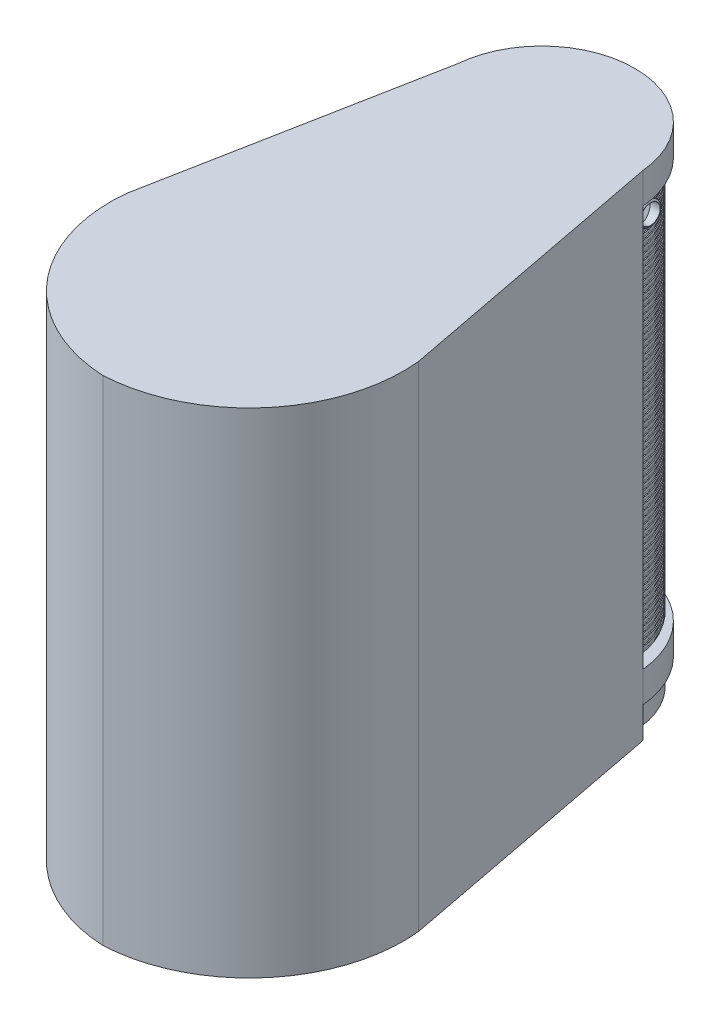
from build123d import *

# Parameters (mm, degrees)
BASE_DEPTH              = 406.4
CUT_FOR_POD_TRASH_DEPTH = 330.2
WATER_AND_CORD_DEPTH    = 330.2
POWER_DEPTH             = 25.4
POD_TRASH_BIN_DEPTH     = 327.66
SKETCH15_W              = 0.762
SKETCH15_H              = 2.54
LPATTERN3_COUNT         = 68
LPATTERN3_PITCH         = 4.826
SKETCH14_R              = 9.525
HOLE_EXTRUDE_DEPTH      = 66.04
FILLET4_R               = 1.27
SKETCH17_R              = 8.001
HOLE_CUT_DEPTH          = 538.507475527
INSIDE_DEPTH            = 317.5


with BuildPart() as part:
    # Sketch1 → Base (new body)
    with BuildSketch(Plane(origin=(0, 0, 0), x_dir=(1, 0, 0), z_dir=(0, 1, 0))):
        with BuildLine():
            Line((-119.997338688, 0), (-76.2, 228.6))
            ThreePointArc((-76.2, 228.6), (-51.663767565, 278.238745322), (0, 298.160764803))
            ThreePointArc((0, 298.160764803), (51.663767565, 278.238745322), (76.2, 228.6))
            Line((76.2, 228.6), (119.997338688, 0))
            ThreePointArc((119.997338688, 0), (89.988820959, -95.610475165), (0, -139.7))
            ThreePointArc((0, -139.7), (-89.988820959, -95.610475165), (-119.997338688, 0))
        make_face()
    extrude(amount=-BASE_DEPTH)

    # Sketch5 → Cut for pod trash (cut)
    with BuildSketch(Plane(origin=(0, -25.4, 0), x_dir=(1, 0, 0), z_dir=(0, 1, 0))):
        with BuildLine():
            Line((-76.2, 228.6), (76.2, 228.6))
            ThreePointArc((76.2, 228.6), (0, 301.750496716), (-76.2, 228.6))
        make_face()
    extrude(amount=-CUT_FOR_POD_TRASH_DEPTH, mode=Mode.SUBTRACT)

    # Sketch7 → water and cord (cut)
    with BuildSketch(Plane(origin=(0, -381, 0), x_dir=(1, 0, 0), z_dir=(0, 1, 0))):
        with BuildLine():
            Line((-76.2, 228.6), (76.2, 228.6))
            ThreePointArc((76.2, 228.6), (0, 307.702334332), (-76.2, 228.6))
        make_face()
    extrude(amount=-WATER_AND_CORD_DEPTH, mode=Mode.SUBTRACT)

    # Sketch10 → power (add)
    with BuildSketch(Plane.XZ.offset(381)):
        with BuildLine():
            Line((66.04, -229.87), (-66.04, -229.87))
            ThreePointArc((-66.04, -229.87), (0, -295.91), (66.04, -229.87))
        make_face()
    extrude(amount=POWER_DEPTH)


with BuildPart() as body_2:
    # Sketch11 → pod trash bin (new body)
    with BuildSketch(Plane(origin=(0, -355.6, 0), x_dir=(1, 0, 0), z_dir=(0, 1, 0))):
        with BuildLine():
            Line((-66.04, 229.87), (66.04, 229.87))
            ThreePointArc((66.04, 229.87), (0, 295.91), (-66.04, 229.87))
        make_face()
    extrude(amount=POD_TRASH_BIN_DEPTH)

    # Sketch15 → Cut-Revolve1 (revolve, cut)
    with BuildSketch(Plane.XY.offset(-229.87)):
        with Locations((65.659, -354.33)):
            Rectangle(SKETCH15_W, SKETCH15_H)
    cut_revolve1 = revolve(axis=Axis((0, 0, -229.87), (0, -1, 0)), mode=Mode.SUBTRACT)

    # LPattern3: Cut-Revolve1 ×68
    with Locations(*[(0, i * LPATTERN3_PITCH, 0) for i in range(1, LPATTERN3_COUNT)]):
        add(cut_revolve1, mode=Mode.SUBTRACT)

    # Sketch14 → Hole extrude (add, symmetric)
    with BuildSketch(Plane(origin=(0, 0, 0), x_dir=(0, 0, -1), z_dir=(1, 0, 0))):
        with Locations((245.11, -44.45)):
            Circle(SKETCH14_R)
    extrude(amount=HOLE_EXTRUDE_DEPTH, both=True)

    # Fillet4
    # the kernel refuses this fillet: 1.27 mm, written as the material it takes off along each edge
    with BuildSketch(Plane(origin=(66.04, -44.45, -245.11), x_dir=(0, 0, -1), z_dir=(0, -1, 0))) as fillet4_piece_1_section:
        with BuildLine():
            CenterArc((9.525 - FILLET4_R, -FILLET4_R), FILLET4_R, 0, 90)
            Line((9.525 - FILLET4_R, 0), (9.525, 0))
            Line((9.525, 0), (9.525, -FILLET4_R))
        make_face()
    fillet4_piece_1 = revolve(axis=Axis((66.04, -44.45, -245.11), (1, 0, 0)), mode=Mode.PRIVATE)
    fillet4_piece_1 = fillet4_piece_1 - Plane(origin=(0, -44.45, -229.87), x_dir=(1, 0, 0), z_dir=(0, -1, 0)) * Cylinder(66.04, 39, mode=Mode.PRIVATE)
    add(fillet4_piece_1, mode=Mode.SUBTRACT)
    with BuildSketch(Plane(origin=(66.04, -44.45, -245.11), x_dir=(0, 0, -1), z_dir=(0, -1, 0))) as fillet4_piece_2_section:
        with BuildLine():
            CenterArc((9.525 - FILLET4_R, -FILLET4_R), FILLET4_R, 0, 90)
            Line((9.525 - FILLET4_R, 0), (9.525, 0))
            Line((9.525, 0), (9.525, -FILLET4_R))
        make_face()
    fillet4_piece_2 = revolve(axis=Axis((66.04, -44.45, -245.11), (1, 0, 0)), mode=Mode.PRIVATE)
    fillet4_piece_2 = split(fillet4_piece_2, bisect_by=Plane(origin=(66.04, -37.084, -245.11), z_dir=(0, 1, 0)), keep=Keep.TOP, mode=Mode.PRIVATE)
    add(fillet4_piece_2, mode=Mode.SUBTRACT)
    with BuildSketch(Plane(origin=(66.04, -44.45, -245.11), x_dir=(0, 0, -1), z_dir=(0, -1, 0))) as fillet4_piece_3_section:
        with BuildLine():
            CenterArc((9.525 - FILLET4_R, -FILLET4_R), FILLET4_R, 0, 90)
            Line((9.525 - FILLET4_R, 0), (9.525, 0))
            Line((9.525, 0), (9.525, -FILLET4_R))
        make_face()
    fillet4_piece_3 = revolve(axis=Axis((66.04, -44.45, -245.11), (1, 0, 0)), mode=Mode.PRIVATE)
    fillet4_piece_3 = split(fillet4_piece_3, bisect_by=Plane(origin=(66.04, -51.562, -245.11), z_dir=(0, 1, 0)), keep=Keep.TOP, mode=Mode.PRIVATE)
    fillet4_piece_3 = fillet4_piece_3 - Plane(origin=(0, -44.45, -229.87), x_dir=(1, 0, 0), z_dir=(0, 1, 0)) * Cylinder(65.278, 39, mode=Mode.PRIVATE)
    fillet4_piece_3 = split(fillet4_piece_3, bisect_by=Plane(origin=(66.04, -49.022, -245.11), z_dir=(0, -1, 0)), keep=Keep.TOP, mode=Mode.PRIVATE)
    add(fillet4_piece_3, mode=Mode.SUBTRACT)
    with BuildSketch(Plane(origin=(66.04, -44.45, -245.11), x_dir=(0, 0, -1), z_dir=(0, -1, 0))) as fillet4_piece_4_section:
        with BuildLine():
            CenterArc((9.525 - FILLET4_R, -FILLET4_R), FILLET4_R, 0, 90)
            Line((9.525 - FILLET4_R, 0), (9.525, 0))
            Line((9.525, 0), (9.525, -FILLET4_R))
        make_face()
    fillet4_piece_4 = revolve(axis=Axis((66.04, -44.45, -245.11), (1, 0, 0)), mode=Mode.PRIVATE)
    fillet4_piece_4 = fillet4_piece_4 - Plane(origin=(0, -44.45, -229.87), x_dir=(1, 0, 0), z_dir=(0, 1, 0)) * Cylinder(65.278, 39, mode=Mode.PRIVATE)
    fillet4_piece_4 = split(fillet4_piece_4, bisect_by=Plane(origin=(66.04, -41.91, -245.11), z_dir=(0, 1, 0)), keep=Keep.TOP, mode=Mode.PRIVATE)
    fillet4_piece_4 = split(fillet4_piece_4, bisect_by=Plane(origin=(66.04, -39.37, -245.11), z_dir=(0, -1, 0)), keep=Keep.TOP, mode=Mode.PRIVATE)
    add(fillet4_piece_4, mode=Mode.SUBTRACT)
    with BuildSketch(Plane(origin=(66.04, -44.45, -245.11), x_dir=(0, 0, -1), z_dir=(0, -1, 0))) as fillet4_piece_5_section:
        with BuildLine():
            CenterArc((9.525 - FILLET4_R, -FILLET4_R), FILLET4_R, 0, 90)
            Line((9.525 - FILLET4_R, 0), (9.525, 0))
            Line((9.525, 0), (9.525, -FILLET4_R))
        make_face()
    fillet4_piece_5 = revolve(axis=Axis((66.04, -44.45, -245.11), (1, 0, 0)), mode=Mode.PRIVATE)
    fillet4_piece_5 = fillet4_piece_5 - Plane(origin=(0, -44.45, -229.87), x_dir=(1, 0, 0), z_dir=(0, 1, 0)) * Cylinder(65.278, 39, mode=Mode.PRIVATE)
    fillet4_piece_5 = split(fillet4_piece_5, bisect_by=Plane(origin=(66.04, -46.736, -245.11), z_dir=(0, 1, 0)), keep=Keep.TOP, mode=Mode.PRIVATE)
    fillet4_piece_5 = split(fillet4_piece_5, bisect_by=Plane(origin=(66.04, -44.196, -245.11), z_dir=(0, -1, 0)), keep=Keep.TOP, mode=Mode.PRIVATE)
    add(fillet4_piece_5, mode=Mode.SUBTRACT)
    with BuildSketch(Plane(origin=(-66.04, -44.45, -245.11), x_dir=(0, 0, -1), z_dir=(0, -1, 0))) as fillet4_piece_6_section:
        with BuildLine():
            CenterArc((9.525 - FILLET4_R, FILLET4_R), FILLET4_R, 270, 90)
            Line((9.525 - FILLET4_R, 0), (9.525, 0))
            Line((9.525, 0), (9.525, FILLET4_R))
        make_face()
    fillet4_piece_6 = revolve(axis=Axis((-66.04, -44.45, -245.11), (1, 0, 0)), mode=Mode.PRIVATE)
    fillet4_piece_6 = fillet4_piece_6 - Plane(origin=(0, -44.45, -229.87), x_dir=(1, 0, 0), z_dir=(0, -1, 0)) * Cylinder(66.04, 39, mode=Mode.PRIVATE)
    add(fillet4_piece_6, mode=Mode.SUBTRACT)
    with BuildSketch(Plane(origin=(-66.04, -44.45, -245.11), x_dir=(0, 0, -1), z_dir=(0, -1, 0))) as fillet4_piece_7_section:
        with BuildLine():
            CenterArc((9.525 - FILLET4_R, FILLET4_R), FILLET4_R, 270, 90)
            Line((9.525 - FILLET4_R, 0), (9.525, 0))
            Line((9.525, 0), (9.525, FILLET4_R))
        make_face()
    fillet4_piece_7 = revolve(axis=Axis((-66.04, -44.45, -245.11), (1, 0, 0)), mode=Mode.PRIVATE)
    fillet4_piece_7 = split(fillet4_piece_7, bisect_by=Plane(origin=(-66.04, -37.084, -245.11), z_dir=(0, 1, 0)), keep=Keep.TOP, mode=Mode.PRIVATE)
    add(fillet4_piece_7, mode=Mode.SUBTRACT)
    with BuildSketch(Plane(origin=(-66.04, -44.45, -245.11), x_dir=(0, 0, -1), z_dir=(0, -1, 0))) as fillet4_piece_8_section:
        with BuildLine():
            CenterArc((9.525 - FILLET4_R, FILLET4_R), FILLET4_R, 270, 90)
            Line((9.525 - FILLET4_R, 0), (9.525, 0))
            Line((9.525, 0), (9.525, FILLET4_R))
        make_face()
    fillet4_piece_8 = revolve(axis=Axis((-66.04, -44.45, -245.11), (1, 0, 0)), mode=Mode.PRIVATE)
    fillet4_piece_8 = fillet4_piece_8 - Plane(origin=(0, -44.45, -229.87), x_dir=(1, 0, 0), z_dir=(0, 1, 0)) * Cylinder(65.278, 39, mode=Mode.PRIVATE)
    fillet4_piece_8 = split(fillet4_piece_8, bisect_by=Plane(origin=(-66.04, -49.022, -245.11), z_dir=(0, -1, 0)), keep=Keep.TOP, mode=Mode.PRIVATE)
    fillet4_piece_8 = split(fillet4_piece_8, bisect_by=Plane(origin=(-66.04, -51.562, -245.11), z_dir=(0, 1, 0)), keep=Keep.TOP, mode=Mode.PRIVATE)
    add(fillet4_piece_8, mode=Mode.SUBTRACT)
    with BuildSketch(Plane(origin=(-66.04, -44.45, -245.11), x_dir=(0, 0, -1), z_dir=(0, -1, 0))) as fillet4_piece_9_section:
        with BuildLine():
            CenterArc((9.525 - FILLET4_R, FILLET4_R), FILLET4_R, 270, 90)
            Line((9.525 - FILLET4_R, 0), (9.525, 0))
            Line((9.525, 0), (9.525, FILLET4_R))
        make_face()
    fillet4_piece_9 = revolve(axis=Axis((-66.04, -44.45, -245.11), (1, 0, 0)), mode=Mode.PRIVATE)
    fillet4_piece_9 = split(fillet4_piece_9, bisect_by=Plane(origin=(-66.04, -39.37, -245.11), z_dir=(0, -1, 0)), keep=Keep.TOP, mode=Mode.PRIVATE)
    fillet4_piece_9 = fillet4_piece_9 - Plane(origin=(0, -44.45, -229.87), x_dir=(1, 0, 0), z_dir=(0, 1, 0)) * Cylinder(65.278, 39, mode=Mode.PRIVATE)
    fillet4_piece_9 = split(fillet4_piece_9, bisect_by=Plane(origin=(-66.04, -41.91, -245.11), z_dir=(0, 1, 0)), keep=Keep.TOP, mode=Mode.PRIVATE)
    add(fillet4_piece_9, mode=Mode.SUBTRACT)
    with BuildSketch(Plane(origin=(-66.04, -44.45, -245.11), x_dir=(0, 0, -1), z_dir=(0, -1, 0))) as fillet4_piece_10_section:
        with BuildLine():
            CenterArc((9.525 - FILLET4_R, FILLET4_R), FILLET4_R, 270, 90)
            Line((9.525 - FILLET4_R, 0), (9.525, 0))
            Line((9.525, 0), (9.525, FILLET4_R))
        make_face()
    fillet4_piece_10 = revolve(axis=Axis((-66.04, -44.45, -245.11), (1, 0, 0)), mode=Mode.PRIVATE)
    fillet4_piece_10 = fillet4_piece_10 - Plane(origin=(0, -44.45, -229.87), x_dir=(1, 0, 0), z_dir=(0, 1, 0)) * Cylinder(65.278, 39, mode=Mode.PRIVATE)
    fillet4_piece_10 = split(fillet4_piece_10, bisect_by=Plane(origin=(-66.04, -44.196, -245.11), z_dir=(0, -1, 0)), keep=Keep.TOP, mode=Mode.PRIVATE)
    fillet4_piece_10 = split(fillet4_piece_10, bisect_by=Plane(origin=(-66.04, -46.736, -245.11), z_dir=(0, 1, 0)), keep=Keep.TOP, mode=Mode.PRIVATE)
    add(fillet4_piece_10, mode=Mode.SUBTRACT)

    # Sketch17 → Hole cut (cut, through all)
    with BuildSketch(Plane(origin=(66.04, 0, 0), x_dir=(0, 0, -1), z_dir=(1, 0, 0))):
        with Locations((245.11, -44.45)):
            Circle(SKETCH17_R)
    extrude(amount=-HOLE_CUT_DEPTH, mode=Mode.SUBTRACT)

    # Sketch18 → Inside (cut)
    with BuildSketch(Plane(origin=(0, -27.94, 0), x_dir=(1, 0, 0), z_dir=(0, 1, 0))):
        with BuildLine():
            Line((62.23, 233.203617899), (-62.23, 233.203617899))
            ThreePointArc((-62.23, 233.203617899), (0, 292.142019852), (62.23, 233.203617899))
        make_face()
    extrude(amount=-INSIDE_DEPTH, mode=Mode.SUBTRACT)


solid = Compound([part.part, body_2.part])
